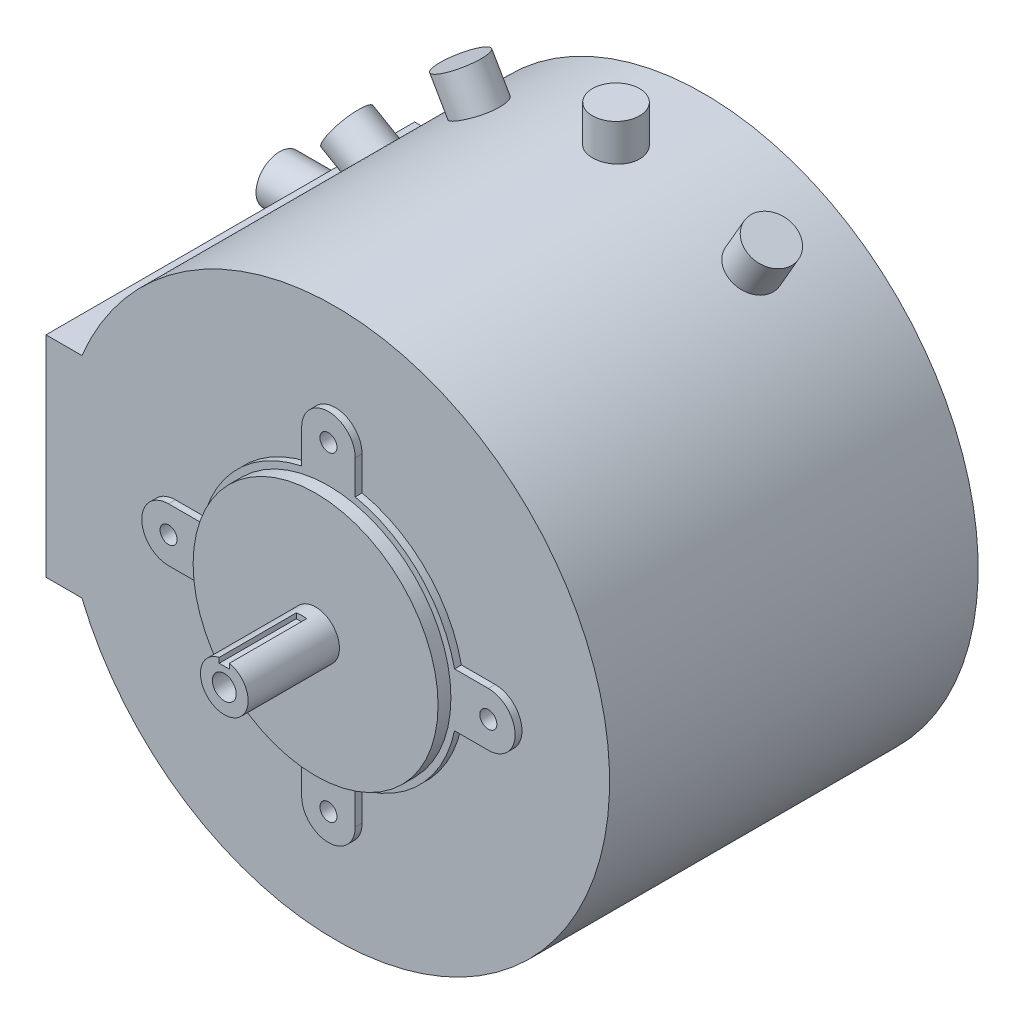
from build123d import *

# Parameters (mm, degrees)
SZKIC1_R                    = 128
DODANIE_WYCI_GNI_CIE1_DEPTH = 172
SZKIC2_W                    = 135
SZKIC2_H                    = 98
DODANIE_WYCI_GNI_CIE2_DEPTH = 172
SZKIC3_R                    = 11
DODANIE_WYCI_GNI_CIE3_DEPTH = 30
SZKIC5_W                    = 11
SZKIC5_H                    = 25
SZYK_START                  = -145
SZYK_KO_OWY1_OUTLINE_R      = 11
SZYK_KO_OWY1_DEPTH          = 17.473532259
SZYK_KO_OWY1_2_OUTLINE_R    = 11
SZYK_KO_OWY1_2_DEPTH        = 17.473532259
SZYK_START_2                = 127.526467741
SZYK_KO_OWY1_3_OUTLINE_R    = 11
SZYK_KO_OWY1_3_DEPTH        = 17.473532259
SZKIC6_R                    = 57.15
DODANIE_WYCI_GNI_CIE4_DEPTH = 9.2
SZKIC7_R                    = 11.115
DODANIE_WYCI_GNI_CIE5_DEPTH = 42.6
SZKIC8_W                    = 4.78
SZKIC8_H                    = 5
WYTNIJ_WYCI_GNI_CIE1_DEPTH  = 36
SZKIC9_R                    = 5.556
WYTNIJ_WYCI_GNI_CIE2_DEPTH  = 30
DODANIE_WYCI_GNI_CIE6_DEPTH = 3.2
SZKIC11_R                   = 3.97
WYTNIJ_WYCI_GNI_CIE3_DEPTH  = 19
SZYK_KO_OWY2_COUNT          = 4
SZKIC12_R                   = 60.15
DODANIE_WYCI_GNI_CIE7_DEPTH = 3.2


# Read off the part's stored shape, not the designer's step: Szyk kołowy1
with BuildPart() as part:
    # Szkic1 → Dodanie-wyciągnięcie1 (new body)
    with BuildSketch(Plane.XY):
        Circle(SZKIC1_R)
    extrude(amount=DODANIE_WYCI_GNI_CIE1_DEPTH)

    # Szkic2 → Dodanie-wyciągnięcie2 (add)
    with BuildSketch(Plane.XY.offset(172)):
        with Locations((-67.5, 0)):
            Rectangle(SZKIC2_W, SZKIC2_H)
    extrude(amount=-DODANIE_WYCI_GNI_CIE2_DEPTH)

    # Szkic3 → Dodanie-wyciągnięcie3 (add)
    with BuildSketch(Plane.ZY.offset(135)):
        with Locations((33, 27.5)):
            Circle(SZKIC3_R)
        with Locations((33, -27.5)):
            Circle(SZKIC3_R)
    extrude(amount=DODANIE_WYCI_GNI_CIE3_DEPTH)

    # Szkic5 → Obrót1 (revolve)
    with BuildSketch(Plane(origin=(0, 0, 41), x_dir=(-1, 0, 0), z_dir=(0, 0, -1)), mode=Mode.PRIVATE) as obr_t1_sk:
        with Locations((-5.5, 132.5)):
            Rectangle(SZKIC5_W, SZKIC5_H)
    revolve(obr_t1_sk.sketch.rotate(Axis((0, 145, 41), (0, -1, 0)), 180), axis=Axis((0, 145, 41), (0, -1, 0)))

    # Szyk kołowy1 outline → Szyk kołowy1 (add)
    with BuildSketch(Plane(origin=(0, 0, 0), x_dir=(0.866025403784438, 0.500000000000001, 0), z_dir=(0.500000000000001, -0.866025403784438, 0)).offset(SZYK_START)):
        with Locations((0, 41)):
            Circle(SZYK_KO_OWY1_OUTLINE_R)
    extrude(amount=SZYK_KO_OWY1_DEPTH)

    # Szyk ko_owy1 2 outline → Szyk ko_owy1 2 (add)
    with BuildSketch(Plane(origin=(0, 0, 0), x_dir=(0.49999999999999767, 0.86602540378444, 0), z_dir=(0.8660254037844399, -0.49999999999999795, 0)).offset(SZYK_START)):
        with Locations((0, 41)):
            Circle(SZYK_KO_OWY1_2_OUTLINE_R)
    extrude(amount=SZYK_KO_OWY1_2_DEPTH)

    # Szyk ko_owy1 3 outline → Szyk ko_owy1 3 (add)
    with BuildSketch(Plane(origin=(0, 0, 0), x_dir=(0.866025403784438, -0.500000000000001, 0), z_dir=(0.500000000000001, 0.866025403784438, 0)).offset(SZYK_START_2)):
        with Locations((0, -41)):
            Circle(SZYK_KO_OWY1_3_OUTLINE_R)
    extrude(amount=SZYK_KO_OWY1_3_DEPTH)

    # Szkic6 → Dodanie-wyciągnięcie4 (add)
    with BuildSketch(Plane.XY.offset(172)):
        Circle(SZKIC6_R)
    extrude(amount=DODANIE_WYCI_GNI_CIE4_DEPTH)

    # Szkic7 → Dodanie-wyciągnięcie5 (add)
    with BuildSketch(Plane.XY.offset(181.2)):
        Circle(SZKIC7_R)
    extrude(amount=DODANIE_WYCI_GNI_CIE5_DEPTH)

    # Szkic8 → Wytnij-wyciągnięcie1 (cut)
    with BuildSketch(Plane.XY.offset(223.8)):
        with Locations((0, 10.965)):
            Rectangle(SZKIC8_W, SZKIC8_H)
    extrude(amount=-WYTNIJ_WYCI_GNI_CIE1_DEPTH, mode=Mode.SUBTRACT)

    # Szkic9 → Wytnij-wyciągnięcie2 (cut)
    with BuildSketch(Plane.XY.offset(223.8)):
        Circle(SZKIC9_R)
    extrude(amount=-WYTNIJ_WYCI_GNI_CIE2_DEPTH, mode=Mode.SUBTRACT)

    # Szkic10 → Dodanie-wyciągnięcie6 (add)
    with BuildSketch(Plane.XY.offset(172)):
        with BuildLine():
            Line((-73.545292167, 12.5), (-74.6, 12.5))
            ThreePointArc((-74.6, 12.5), (-87.1, 0), (-74.6, -12.5))
            Line((-74.6, -12.5), (-73.545292167, -12.5))
            Line((-73.545292167, -12.5), (-55.766230821, -12.5))
            ThreePointArc((-55.766230821, -12.5), (-57.15, 0), (-55.766230821, 12.5))
            Line((-55.766230821, 12.5), (-73.545292167, 12.5))
        make_face()
    dodanie_wyci_gni_cie6 = extrude(amount=DODANIE_WYCI_GNI_CIE6_DEPTH)

    # Szkic11 → Wytnij-wyciągnięcie3 (cut)
    with BuildSketch(Plane.XY.offset(175.2)):
        with Locations((-74.6, 0)):
            Circle(SZKIC11_R)
    wytnij_wyci_gni_cie3 = extrude(amount=-WYTNIJ_WYCI_GNI_CIE3_DEPTH, mode=Mode.SUBTRACT)

    # Szyk kołowy2: Dodanie-wyciągnięcie6, Wytnij-wyciągnięcie3 ×4 about axis
    szyk_ko_owy2_axis = Axis((0, 0, 0), (0, 0, 1))
    add([dodanie_wyci_gni_cie6.rotate(szyk_ko_owy2_axis, i * 360 / SZYK_KO_OWY2_COUNT) for i in range(1, SZYK_KO_OWY2_COUNT)])
    add([wytnij_wyci_gni_cie3.rotate(szyk_ko_owy2_axis, i * 360 / SZYK_KO_OWY2_COUNT) for i in range(1, SZYK_KO_OWY2_COUNT)], mode=Mode.SUBTRACT)

    # Szkic12 → Dodanie-wyciągnięcie7 (add)
    with BuildSketch(Plane.XY.offset(172)):
        Circle(SZKIC12_R)
    extrude(amount=DODANIE_WYCI_GNI_CIE7_DEPTH)


solid = part.part
